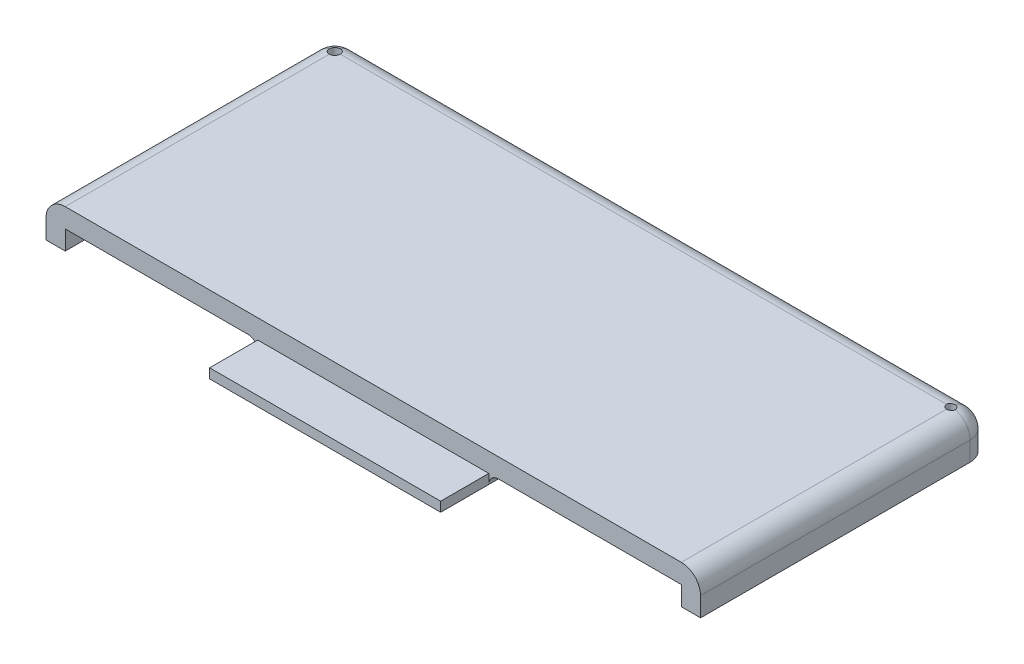
from build123d import *

# Parameters (mm, degrees)
SKETCH1_W           = 170
SKETCH1_H           = 70
BOSS_EXTRUDE1_DEPTH = 90
FILLET2_R           = 5
SKETCH5_R           = 1.4
CUT_EXTRUDE2_DEPTH  = 12
CUT_EXTRUDE3_DEPTH  = 170
SKETCH7_W           = 158.942349138
SKETCH7_H           = 5
CUT_EXTRUDE4_DEPTH  = 70
SKETCH9_W           = 1.057650862
SKETCH9_H           = 5
SKETCH9_W_2         = 2.044997
CUT_EXTRUDE5_DEPTH  = 70
SKETCH12_W          = 5
SKETCH12_H          = 5
BOSS_EXTRUDE2_DEPTH = 75
SKETCH13_R          = 5
BOSS_EXTRUDE4_DEPTH = 5
SKETCH14_R          = 1.4
SKETCH14_R_2        = 1.115846917
CUT_EXTRUDE6_DEPTH  = 10
FILLET3_R           = 5
BOSS_EXTRUDE5_DEPTH = 2.5
SKETCH16_W          = 60
SKETCH16_H          = 2.5
BOSS_EXTRUDE6_DEPTH = 12.5
FILLET4_R           = 2.5


# Some blends are built 0.0001 mm under size
with BuildPart() as part:
    # Sketch1 → Boss-Extrude1 (new body)
    with BuildSketch(Plane.XY):
        Rectangle(SKETCH1_W, SKETCH1_H)
    extrude(amount=BOSS_EXTRUDE1_DEPTH)

    # Fillet2
    fillet2_edges = [part.edges().sort_by_distance(p)[0] for p in [
        (85, -35, 45),
        (-85, -35, 45),
        (-85, 35, 45),
        (85, 35, 45),
    ]]
    fillet(fillet2_edges, radius=FILLET2_R)

    # Sketch5 → Cut-Extrude2 (cut)
    with BuildSketch(Plane.XY.offset(90)):
        with Locations((-80, 30)):
            Circle(SKETCH5_R)
        with Locations((-80, -30)):
            Circle(SKETCH5_R)
        with Locations((80, 30)):
            Circle(SKETCH5_R)
        with Locations((80, -30)):
            Circle(SKETCH5_R)
    extrude(amount=-CUT_EXTRUDE2_DEPTH, mode=Mode.SUBTRACT)

    # Sketch6 → Cut-Extrude3 (cut)
    with BuildSketch(Plane.ZY.offset(85)):
        Polygon((0, 25), (0, -35), (90, -35), (90, 35), (75, 35), (75, 25), align=None)
    extrude(amount=-CUT_EXTRUDE3_DEPTH, mode=Mode.SUBTRACT)

    # Sketch7 → Cut-Extrude4 (cut)
    with BuildSketch(Plane.XY.offset(75)):
        with Locations((0.528825431, 27.5)):
            Rectangle(SKETCH7_W, SKETCH7_H)
    extrude(amount=-CUT_EXTRUDE4_DEPTH, mode=Mode.SUBTRACT)

    # Sketch9 → Cut-Extrude5 (cut)
    with BuildSketch(Plane.XY.offset(75)):
        with Locations((-79.471174569, 27.5)):
            Rectangle(SKETCH9_W, SKETCH9_H)
        with Locations((81.0224985, 27.5)):
            Rectangle(SKETCH9_W_2, SKETCH9_H)
    extrude(amount=-CUT_EXTRUDE5_DEPTH, mode=Mode.SUBTRACT)

    # Sketch12 → Boss-Extrude2 (add)
    with BuildSketch(Plane.XY.offset(75)):
        with Locations((82.5, 27.5)):
            Rectangle(SKETCH12_W, SKETCH12_H)
    extrude(amount=-BOSS_EXTRUDE2_DEPTH)

    # Sketch13 → Boss-Extrude4 (add)
    with BuildSketch(Plane(origin=(0, 25, 0), x_dir=(-1, 0, 0), z_dir=(0, -1, 0))):
        with Locations((-80, -5)):
            Circle(SKETCH13_R)
        with Locations((80, -5)):
            Circle(SKETCH13_R)
    extrude(amount=-BOSS_EXTRUDE4_DEPTH)

    # Sketch14 → Cut-Extrude6 (cut)
    with BuildSketch(Plane.XZ.offset(-25)):
        with Locations((-80, 5)):
            Circle(SKETCH14_R)
        with Locations((80, 5)):
            Circle(SKETCH14_R_2)
    extrude(amount=-CUT_EXTRUDE6_DEPTH, mode=Mode.SUBTRACT)

    # Fillet3
    # the kernel refuses this fillet: 5 mm, written as the material it takes off along each edge
    with BuildSketch(Plane(origin=(-80, 35, 0), x_dir=(0, 0, 1), z_dir=(1, 0, 0))) as fillet3_piece_1:
        with BuildLine():
            CenterArc((FILLET3_R, FILLET3_R), FILLET3_R, 180, 90)
            Line((0, FILLET3_R), (0, 0))
            Line((0, 0), (FILLET3_R, 0))
        make_face()
    extrude(amount=160, mode=Mode.SUBTRACT)
    with BuildSketch(Plane(origin=(80, 30, 0), x_dir=(0, 1, 0), z_dir=(-1, 0, 0))) as fillet3_piece_2:
        with BuildLine():
            CenterArc((5 - FILLET3_R, -FILLET3_R), FILLET3_R, 0, 90)
            Line((5, -FILLET3_R), (5, 0))
            Line((5, 0), (5 - FILLET3_R, 0))
        make_face()
    revolve(axis=Axis((80, 30, 0), (0, 0, -1)), revolution_arc=90, mode=Mode.SUBTRACT)
    with BuildSketch(Plane(origin=(85, 30, 0), x_dir=(-1, 0, 0), z_dir=(0, -1, 0)), Plane(origin=(-85, 12.5, 0), x_dir=(1, 0, 0), z_dir=(0, 1, 0))) as fillet3_piece_3:
        with BuildLine():
            CenterArc((FILLET3_R, -FILLET3_R), FILLET3_R, 90, 90)
            Line((0, -FILLET3_R), (0, 0))
            Line((0, 0), (FILLET3_R, 0))
        make_face()
    extrude(amount=17.5, mode=Mode.SUBTRACT)
    with BuildSketch(Plane(origin=(-80, 30, 0), x_dir=(0, 1, 0), z_dir=(1, 0, 0))) as fillet3_piece_4:
        with BuildLine():
            CenterArc((5 - FILLET3_R, FILLET3_R), FILLET3_R, 270, 90)
            Line((5, FILLET3_R), (5, 0))
            Line((5, 0), (5 - FILLET3_R, 0))
        make_face()
    revolve(axis=Axis((-80, 30, 0), (0, 0, 1)), revolution_arc=90, mode=Mode.SUBTRACT)

    # Sketch15 → Boss-Extrude5 (add)
    with BuildSketch(Plane.XZ.offset(-30)):
        Polygon((0, 75), (30, 75), (30, 67.5), (-30, 67.5), (-30, 75), align=None)
    extrude(amount=BOSS_EXTRUDE5_DEPTH)

    # Sketch16 → Boss-Extrude6 (add)
    with BuildSketch(Plane.XY.offset(75)):
        with Locations((0, 28.75)):
            Rectangle(SKETCH16_W, SKETCH16_H)
    extrude(amount=BOSS_EXTRUDE6_DEPTH)

    # Fillet4
    fillet4_edges = [part.edges().sort_by_distance(p)[0] for p in [
        (-30, 30, 71.25),
        (0, 30, 67.5),
        (30, 30, 71.25),
    ]]
    fillet(fillet4_edges, radius=FILLET4_R - 0.0001)  # a hair under: the kernel refuses the full size


solid = part.part
